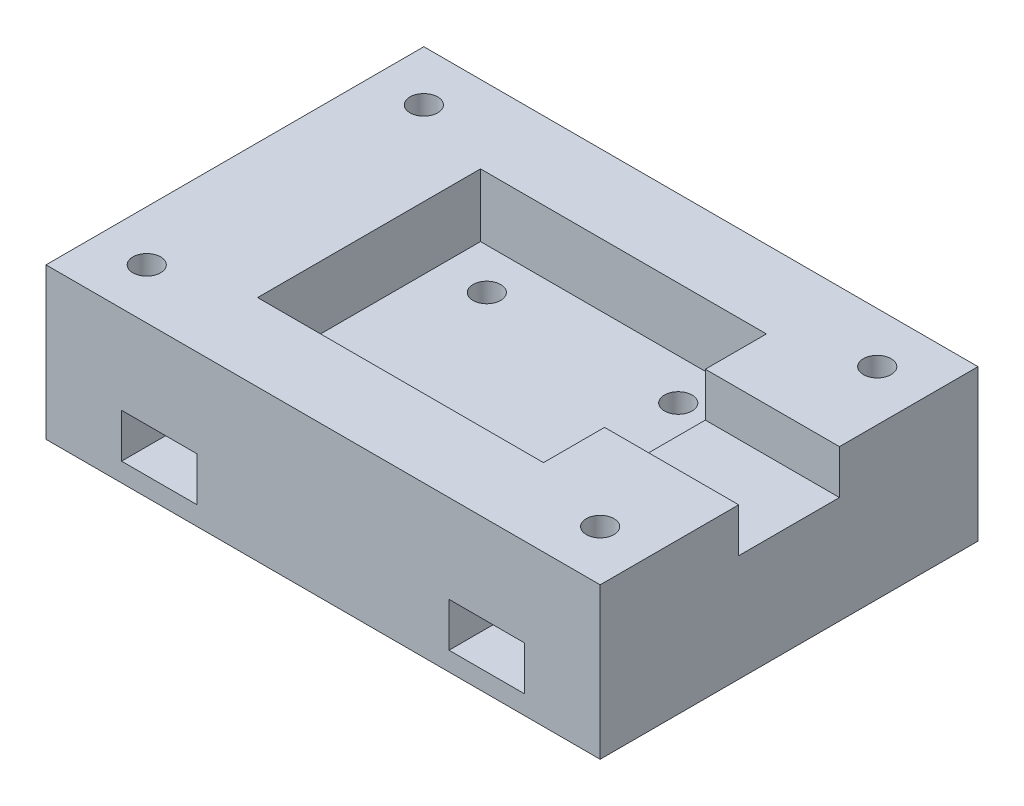
from build123d import *

# Parameters (mm, degrees)
SKETCH1_W               = 44
SKETCH1_H               = 30
POD_BODY_DEPTH          = 12
SKETCH2_W               = 22.7
SKETCH2_H               = 17.7
BOARD_POCKET_DEPTH      = 5
SKETCH3_R               = 1.1
BOARD_PILOT_HOLES_DEPTH = 9
SKETCH4_R               = 1.1
LID_PILOT_HOLES_DEPTH   = 8
SKETCH5_W               = 12.65
SKETCH5_H               = 8
CABLE_EXIT_DEPTH        = 3.5
STRAP_SLOTS_DEPTH       = 30.206163733
STRAP_SLOTS_DEPTH_BACK  = 30.206163733
SKETCH7_W               = 6
SKETCH7_H               = 3.5


with BuildPart() as part:
    # Sketch1 → Pod Body (new body)
    with BuildSketch(Plane(origin=(0, 0, 0), x_dir=(1, 0, 0), z_dir=(0, 1, 0))):
        Rectangle(SKETCH1_W, SKETCH1_H)
    extrude(amount=POD_BODY_DEPTH)

    # Sketch2 → Board Pocket (cut)
    with BuildSketch(Plane(origin=(0, 12, 0), x_dir=(1, 0, 0), z_dir=(0, 1, 0))):
        Rectangle(SKETCH2_W, SKETCH2_H)
    extrude(amount=-BOARD_POCKET_DEPTH, mode=Mode.SUBTRACT)

    # Sketch3 → Board Pilot Holes (cut)
    with BuildSketch(Plane(origin=(0, 12, 0), x_dir=(1, 0, 0), z_dir=(0, 1, 0))):
        with Locations((-7.6, 5.6)):
            Circle(SKETCH3_R)
        with Locations((7.6, 5.6)):
            Circle(SKETCH3_R)
    extrude(amount=-BOARD_PILOT_HOLES_DEPTH, mode=Mode.SUBTRACT)

    # Sketch4 → Lid Pilot Holes (cut)
    with BuildSketch(Plane(origin=(0, 12, 0), x_dir=(1, 0, 0), z_dir=(0, 1, 0))):
        with Locations((-18, -11)):
            Circle(SKETCH4_R)
        with Locations((-18, 11)):
            Circle(SKETCH4_R)
        with Locations((18, -11)):
            Circle(SKETCH4_R)
        with Locations((18, 11)):
            Circle(SKETCH4_R)
    extrude(amount=-LID_PILOT_HOLES_DEPTH, mode=Mode.SUBTRACT)

    # Sketch5 → Cable Exit (cut)
    with BuildSketch(Plane(origin=(0, 12, 0), x_dir=(1, 0, 0), z_dir=(0, 1, 0))):
        with Locations((16.675, 0)):
            Rectangle(SKETCH5_W, SKETCH5_H)
    extrude(amount=-CABLE_EXIT_DEPTH, mode=Mode.SUBTRACT)

    # Sketch7 → Strap Slots (cut, two sides: drawn at the far end of the back side and taken through both)
    with BuildSketch(Plane.XY.offset(-STRAP_SLOTS_DEPTH_BACK)):
        with Locations((-13, 3.25)):
            Rectangle(SKETCH7_W, SKETCH7_H)
        with Locations((13, 3.25)):
            Rectangle(SKETCH7_W, SKETCH7_H)
    extrude(amount=STRAP_SLOTS_DEPTH + STRAP_SLOTS_DEPTH_BACK, mode=Mode.SUBTRACT)


solid = part.part
